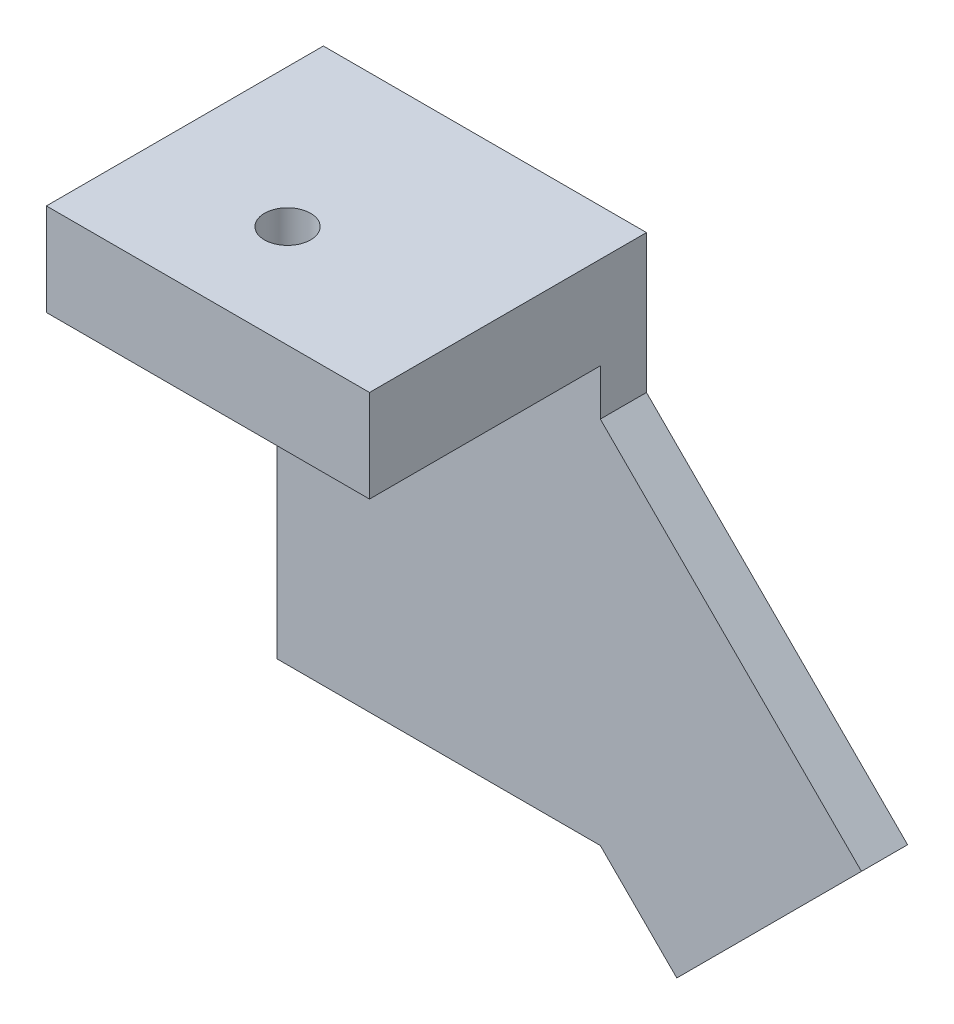
from build123d import *

# Parameters (mm, degrees)
BOSS_EXTRUDE1_DEPTH = 5
SKETCH3_W           = 35
SKETCH3_H           = 10
BOSS_EXTRUDE2_DEPTH = 25
SKETCH4_R           = 2.5
CUT_EXTRUDE1_DEPTH  = 84.672567075
RIB1_REACH          = 80.647
SKETCH6_WALL_W      = 194.558430004
SKETCH6_WALL_H      = 5


with BuildPart() as part:
    # Sketch1 → Boss-Extrude1 (new body)
    with BuildSketch(Plane.XY):
        Polygon((17.5, 27.5), (17.5, 12.5), (45.784271247, -15.784271247), (25.784271247, -35.784271247), (17.5, -27.5), (-17.5, -27.5), (-17.5, 27.5), align=None)
    extrude(amount=BOSS_EXTRUDE1_DEPTH)

    # Sketch3 → Boss-Extrude2 (add)
    with BuildSketch(Plane.XY.offset(5)):
        with Locations((0, 22.5)):
            Rectangle(SKETCH3_W, SKETCH3_H)
    extrude(amount=BOSS_EXTRUDE2_DEPTH)

    # Sketch4 → Cut-Extrude1 (cut, through all)
    with BuildSketch(Plane(origin=(0, 27.5, 0), x_dir=(1, 0, 0), z_dir=(0, 1, 0))):
        with Locations((-2.5, -18.88)):
            Circle(SKETCH4_R)
    extrude(amount=-CUT_EXTRUDE1_DEPTH, mode=Mode.SUBTRACT)

    # Sketch6 wall → Rib1 (add, up to next)
    with BuildSketch(Plane(origin=(-17.5, 5.064928397, 17.5), x_dir=(0, -0.705263155933, -0.708945612077), z_dir=(0, -0.708945612077, 0.705263155933)), mode=Mode.PRIVATE) as rib1_sk1:
        with Locations((0, 2.5)):
            Rectangle(SKETCH6_WALL_W, SKETCH6_WALL_H)
    rib1_tool1 = extrude(rib1_sk1.sketch, amount=-RIB1_REACH, mode=Mode.PRIVATE) - part.part
    add(rib1_tool1.solids().sort_by_distance((-17.5, 5.064928397, 17.5))[0])


solid = part.part
